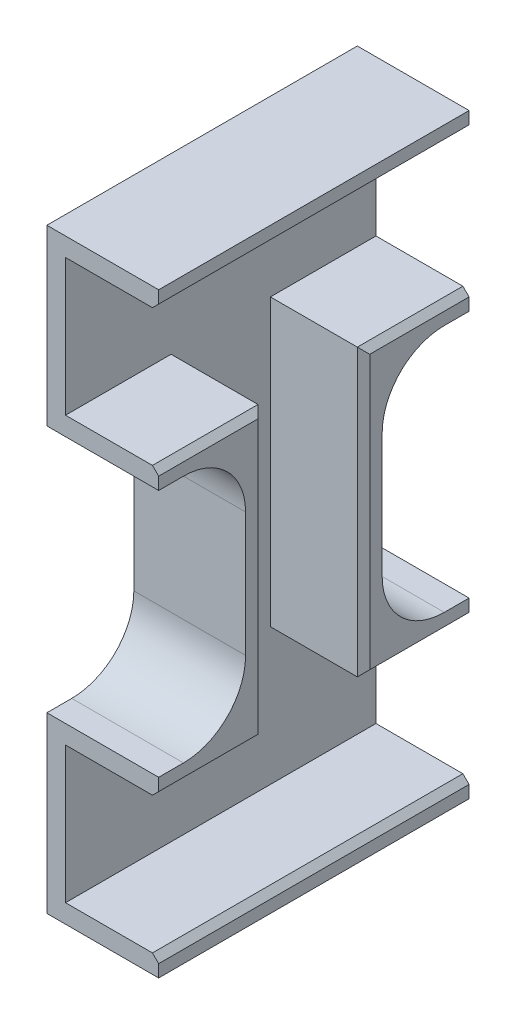
from build123d import *

# Parameters (mm, degrees)
BOSS_EXTRUDE1_DEPTH = 18
CUT_EXTRUDE1_DEPTH  = 15
FILLET1_R           = 10
CHAMFER1_SIZE       = 1


with BuildPart() as part:
    # Sketch1 → Boss-Extrude1 (new body)
    with BuildSketch(Plane(origin=(0, 0, 0), x_dir=(0, 0, -1), z_dir=(1, 0, 0))):
        Polygon((0, 28), (0, 0), (50, 0), (50, 28), (36, 28), (36, 68), (50, 68), (50, 96), (0, 96), (0, 68), (14, 68), (14, 28), align=None)
    extrude(amount=BOSS_EXTRUDE1_DEPTH)

    # Sketch2 → Cut-Extrude1 (cut)
    with BuildSketch(Plane(origin=(18, 0, 0), x_dir=(0, 0, -1), z_dir=(1, 0, 0))):
        Polygon((50, 93), (0, 93), (0, 71), (17, 71), (17, 25), (0, 25), (0, 3), (50, 3), (50, 25), (33, 25), (33, 71), (50, 71), align=None)
    extrude(amount=-CUT_EXTRUDE1_DEPTH, mode=Mode.SUBTRACT)

    # Fillet1
    fillet1_edges = [part.edges().sort_by_distance(p)[0] for p in [
        (9, 28, -36),
        (9, 68, -36),
        (9, 28, -14),
        (9, 68, -14),
    ]]
    fillet(fillet1_edges, radius=FILLET1_R)

    # Chamfer1
    chamfer1_edges = [part.edges().sort_by_distance(p)[0] for p in [
        (18, 3, -25),
        (18, 93, -25),
        (18, 25, -8.5),
        (18, 48, -17),
        (18, 71, -8.5),
        (18, 25, -41.5),
        (18, 48, -33),
        (18, 71, -41.5),
    ]]
    chamfer(chamfer1_edges, length=CHAMFER1_SIZE)


solid = part.part
